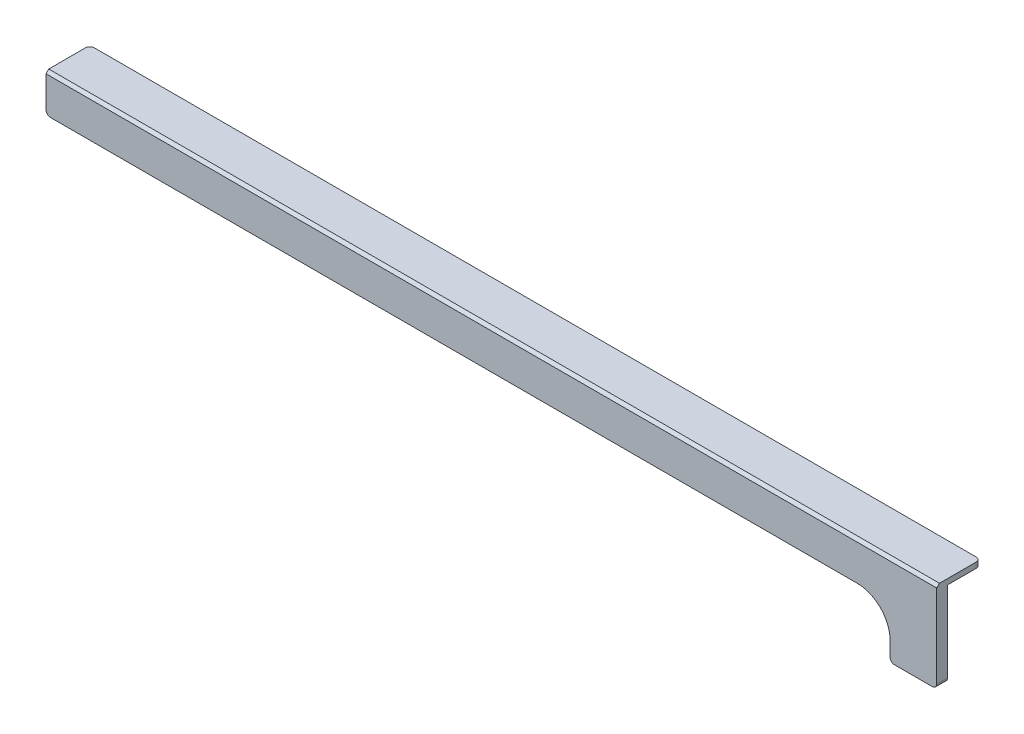
from build123d import *

# Parameters (mm, degrees)
BOSS_EXTRUDE1_DEPTH                          = 4
SKETCH3_W                                    = 324.79935
SKETCH3_H                                    = 12
BOSS_EXTRUDE2_DEPTH                          = 2
FILLET1_SIZE                                 = 1
FILLET2_R                                    = 1.6
FILLET3_R                                    = 12
TAP_DRILL_FOR_M3X0_5_TAP1_D                  = 2.5
TAP_DRILL_FOR_M3X0_5_TAP1_DEPTH              = 7
TAP_DRILL_FOR_M3X0_5_TAP1_CSINK_D            = 2.55
TAP_DRILL_FOR_M3X0_5_TAP1_CSINK_ANGLE        = 90
TAP_DRILL_FOR_M3X0_5_TAP1_TIP                = 0.751075774
CBORE_FOR_M2_5_HEX_SOCKET_HEAD_CAP_S_2_COUNT = 2
CBORE_FOR_M2_5_HEX_SOCKET_HEAD_CAP_S_2_PITCH = 343.399675
CBORE_FOR_M2_5_HEX_SOCKET_HEAD_CAP_S_3_COUNT = 2
CBORE_FOR_M2_5_HEX_SOCKET_HEAD_CAP_S_3_PITCH = 368.708491499
CBORE_FOR_M2_5_HEX_SOCKET_HEAD_CAP_S_4_COUNT = 2
CBORE_FOR_M2_5_HEX_SOCKET_HEAD_CAP_S_4_PITCH = 275.571605445
CBORE_FOR_M2_5_HEX_SOCKET_HEAD_CAP_S_5_COUNT = 2
CBORE_FOR_M2_5_HEX_SOCKET_HEAD_CAP_S_5_PITCH = 169.050630981
CBORE_FOR_M2_5_HEX_SOCKET_HEAD_CAP_S_6_COUNT = 2
CBORE_FOR_M2_5_HEX_SOCKET_HEAD_CAP_S_6_PITCH = 134.248333


with BuildPart() as part:
    # Sketch2 → Boss-Extrude1 (new body)
    with BuildSketch(Plane.XY.offset(14.1038)):
        Polygon((-159.224575, 59.6246), (-159.224575, 73.6246), (165.574775, 73.6246), (165.574775, 59.6246), (165.574775, 40.6744), (148.575775, 40.6744), (148.575775, 59.6246), align=None)
    extrude(amount=-BOSS_EXTRUDE1_DEPTH)

    # Sketch3 → Boss-Extrude2 (add)
    with BuildSketch(Plane(origin=(0, 73.6246, 0), x_dir=(1, 0, 0), z_dir=(0, 1, 0))):
        with Locations((3.1751, -4.1038)):
            Rectangle(SKETCH3_W, SKETCH3_H)
    extrude(amount=-BOSS_EXTRUDE2_DEPTH)

    # Fillet1
    fillet1_edges = [part.edges().sort_by_distance(p)[0] for p in [
        (3.1751, 73.6246, 14.1038),
    ]]
    chamfer(fillet1_edges, length=FILLET1_SIZE)

    # Fillet2
    fillet2_edges = [part.edges().sort_by_distance(p)[0] for p in [
        (-159.224575, 72.6246, -1.8962),
        (165.574775, 72.6246, -1.8962),
        (165.574775, 40.6744, 12.1038),
        (148.575775, 40.6744, 12.1038),
        (-159.224575, 59.6246, 12.1038),
    ]]
    fillet(fillet2_edges, radius=FILLET2_R)

    # Fillet3
    fillet3_edges = [part.edges().sort_by_distance(p)[0] for p in [
        (148.575775, 59.6246, 12.1038),
    ]]
    fillet(fillet3_edges, radius=FILLET3_R)

    # Tap Drill for M3x0.5 Tap1
    with Locations(Plane(origin=(0, 0, 5.0798), x_dir=(-1, 0, 0), z_dir=(0, 0, -1))):
        with Locations((-106.614905, 66.623653), (-37.655035, 66.623653), (31.304835, 66.623653), (100.264705, 66.623653), (100.264705, -66.62476), (31.304835, -66.62476), (-37.655035, -66.62476), (-106.614905, -66.62476)):
            CounterSinkHole(TAP_DRILL_FOR_M3X0_5_TAP1_D / 2, TAP_DRILL_FOR_M3X0_5_TAP1_CSINK_D / 2, depth=TAP_DRILL_FOR_M3X0_5_TAP1_DEPTH, counter_sink_angle=TAP_DRILL_FOR_M3X0_5_TAP1_CSINK_ANGLE)
            with Locations((0, 0, -(TAP_DRILL_FOR_M3X0_5_TAP1_DEPTH + TAP_DRILL_FOR_M3X0_5_TAP1_TIP / 2))):  # 118° drill point
                Cone(0, TAP_DRILL_FOR_M3X0_5_TAP1_D / 2, TAP_DRILL_FOR_M3X0_5_TAP1_TIP, mode=Mode.SUBTRACT)

    # Sketch7 → CBORE for M2.5 Hex Socket Head Cap Screw1 (revolve, cut)
    with BuildSketch(Plane(origin=(-168.5247375, -67.1242065, -6), x_dir=(0, 1, 0), z_dir=(1, 0, 0))):
        Polygon((0, 0), (0, 18.871247898), (1.45, 18), (1.45, 5.9), (2.75, 5.9), (2.75, 0.025), (2.775, 0), align=None)
    cbore_for_m2_5_hex_socket_head_cap_screw = revolve(axis=Axis((-168.5247375, -67.1242065, -12.35), (0, 0, 1)), mode=Mode.SUBTRACT)

    # CBORE for M2.5 Hex Socket Head Cap S 2: CBORE for M2.5 Hex Socket Head Cap Screw1 ×2
    with Locations(*[(i * CBORE_FOR_M2_5_HEX_SOCKET_HEAD_CAP_S_2_PITCH, 0, 0) for i in range(1, CBORE_FOR_M2_5_HEX_SOCKET_HEAD_CAP_S_2_COUNT)]):
        add(cbore_for_m2_5_hex_socket_head_cap_screw, mode=Mode.SUBTRACT)

    # CBORE for M2.5 Hex Socket Head Cap S 3: CBORE for M2.5 Hex Socket Head Cap Screw1 ×2
    with Locations(*[Vector(0.9313581946648414, 0.36410426148377817, 0) * (i * CBORE_FOR_M2_5_HEX_SOCKET_HEAD_CAP_S_3_PITCH) for i in range(1, CBORE_FOR_M2_5_HEX_SOCKET_HEAD_CAP_S_3_COUNT)]):
        add(cbore_for_m2_5_hex_socket_head_cap_screw, mode=Mode.SUBTRACT)

    # CBORE for M2.5 Hex Socket Head Cap S 4: CBORE for M2.5 Hex Socket Head Cap Screw1 ×2
    with Locations(*[Vector(0.8733109752429136, 0.48716315595524184, 0) * (i * CBORE_FOR_M2_5_HEX_SOCKET_HEAD_CAP_S_4_PITCH) for i in range(1, CBORE_FOR_M2_5_HEX_SOCKET_HEAD_CAP_S_4_COUNT)]):
        add(cbore_for_m2_5_hex_socket_head_cap_screw, mode=Mode.SUBTRACT)

    # CBORE for M2.5 Hex Socket Head Cap S 5: CBORE for M2.5 Hex Socket Head Cap Screw1 ×2
    with Locations(*[Vector(0.6077467259578415, 0.7941309193624967, 0) * (i * CBORE_FOR_M2_5_HEX_SOCKET_HEAD_CAP_S_5_PITCH) for i in range(1, CBORE_FOR_M2_5_HEX_SOCKET_HEAD_CAP_S_5_COUNT)]):
        add(cbore_for_m2_5_hex_socket_head_cap_screw, mode=Mode.SUBTRACT)

    # CBORE for M2.5 Hex Socket Head Cap S 6: CBORE for M2.5 Hex Socket Head Cap Screw1 ×2
    with Locations(*[(0, i * CBORE_FOR_M2_5_HEX_SOCKET_HEAD_CAP_S_6_PITCH, 0) for i in range(1, CBORE_FOR_M2_5_HEX_SOCKET_HEAD_CAP_S_6_COUNT)]):
        add(cbore_for_m2_5_hex_socket_head_cap_screw, mode=Mode.SUBTRACT)


solid = part.part
